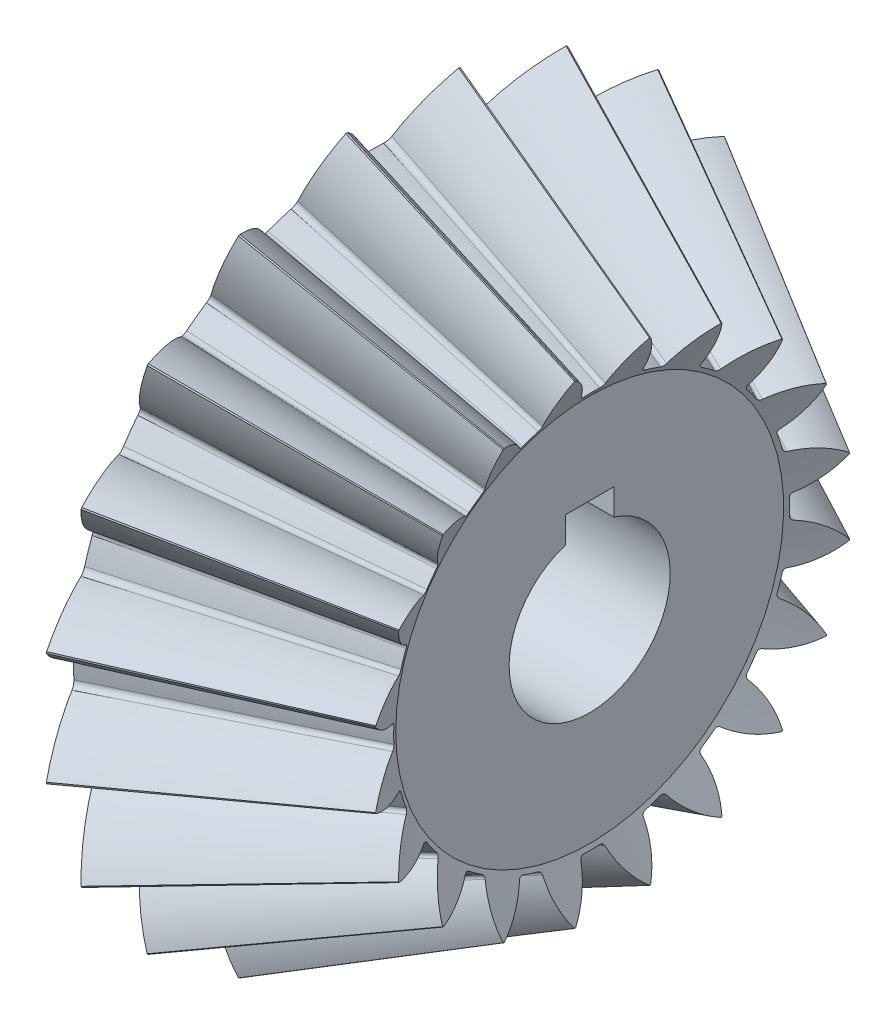
from build123d import *

# Parameters (mm, degrees)
TEETHCUTS_COUNT = 20
TEETHCUTS_ANGLE = 342
HUBSKE_R        = 20
HUB_DEPTH       = 8.114537278
BORSKE_R        = 10
BORE_DEPTH      = 90.0000508
KEYSKE_W        = 6
KEYSKE_H        = 12.8
KEYWAY_DEPTH    = 90.0000508


with BuildPart() as part:
    # BasProSke → Base-Revolve (revolve)
    with BuildSketch(Plane(origin=(0, 0, 0), x_dir=(1, 0, 0), z_dir=(0, 1, 0)), mode=Mode.PRIVATE) as base_revolve_sk:
        Polygon((0, 0), (0, 36.228871357), (4.29157347, 44.812018286), (30.317389192, 29.781610406), (27.465253224, 24.077338479), (27.465253224, 0), align=None)
    revolve(base_revolve_sk.sketch.rotate(Axis((-10, 0, 0), (1, 0, 0)), 180), axis=Axis((-10, 0, 0), (1, 0, 0)))

    # ToothCut: read off the stored shape, not the designer's step
    # ToothCut: loft between two sections, ruled curve by curve
    toothcut_from = [
        Edge.make_bspline([(81.888933635, 0.006738621, -0.010223894), (81.886373247, 0.001617846, -0.014442833), (81.883216481, -0.004695686, -0.013575936), (81.881188729, -0.008751189, -0.008097023)], [0, 0, 0, 0, 1, 1, 1, 1], 3, [1, 0.817810114, 0.817810114, 1]),
        Edge.make_bspline([(81.881188729, -0.008751189, 0.008097023), (81.883216481, -0.004695686, 0.013575936), (81.886373247, 0.001617846, 0.014442833), (81.888933635, 0.006738621, 0.010223894)], [0, 0, 0, 0, 1, 1, 1, 1], 3, [1, 0.817810114, 0.817810114, 1]),
        Edge.make_bspline([(81.881188729, -0.008751189, -0.008097023), (81.880870911, -0.009386825, -0.00723829), (81.880606097, -0.009916453, -0.006293922), (81.880398844, -0.010330959, -0.00528017)], [0, 0, 0, 0, 1, 1, 1, 1], 3, [1, 0.994263946, 0.994263946, 1]),
        Edge.make_bspline([(81.880398844, -0.010330959, 0.00528017), (81.880606097, -0.009916453, 0.006293922), (81.880870911, -0.009386825, 0.00723829), (81.881188729, -0.008751189, 0.008097023)], [0, 0, 0, 0, 1, 1, 1, 1], 3, [1, 0.994263946, 0.994263946, 1]),
        Edge.make_bspline([(81.880398844, -0.010330959, -0.00528017), (81.879702298, -0.011724052, -0.0018731), (81.879702298, -0.011724052, 0.0018731), (81.880398844, -0.010330959, 0.00528017)], [0, 0, 0, 0, 1, 1, 1, 1], 3, [1, 0.939649153, 0.939649153, 1]),
        Edge.make_line((81.888933635, 0.006738621, 0.010223894), (81.888933635, 0.006738621, -0.010223894)),
    ]
    toothcut_to = [
        Edge.make_bspline([(4.40365816, 45.036187664, -7.770946678), (3.430833377, 43.090538102, -5.047579314), (2.123323312, 40.475517975, -3.150013178), (0.614801209, 37.458473774, -2.272245878)], [0, 0, 0, 0, 1, 1, 1, 1], 3, [1, 0.965921678, 0.965921678, 1]),
        Edge.make_bspline([(0.614801209, 37.458473774, 2.272245878), (2.123323312, 40.475517975, 3.150013178), (3.430833377, 43.090538102, 5.047579314), (4.40365816, 45.036187664, 7.770946678)], [0, 0, 0, 0, 1, 1, 1, 1], 3, [1, 0.965921678, 0.965921678, 1]),
        Edge.make_bspline([(0.614801209, 37.458473774, -2.272245878), (0.454744156, 37.138359667, -2.179113104), (0.356313014, 36.941497384, -1.881923658), (0.363142279, 36.955155915, -1.512421532)], [0, 0, 0, 0, 1, 1, 1, 1], 3, [1, 0.852233433, 0.852233433, 1]),
        Edge.make_bspline([(0.363142279, 36.955155915, 1.512421532), (0.356313014, 36.941497384, 1.881923658), (0.454744156, 37.138359667, 2.179113104), (0.614801209, 37.458473774, 2.272245878)], [0, 0, 0, 0, 1, 1, 1, 1], 3, [1, 0.852233433, 0.852233433, 1]),
        Edge.make_bspline([(0.363142279, 36.955155915, -1.512421532), (0.381772376, 36.992416108, -0.504427328), (0.381772376, 36.992416108, 0.504427328), (0.363142279, 36.955155915, 1.512421532)], [0, 0, 0, 0, 1, 1, 1, 1], 3, [1, 0.9994314, 0.9994314, 1]),
        Edge.make_line((4.40365816, 45.036187664, 7.770946678), (4.40365816, 45.036187664, -7.770946678)),
    ]
    toothcut = Solid(Shell([*[Face.make_surface_from_curves(toothcut_from[k], toothcut_to[k]) for k in range(6)], Face(Wire(toothcut_from)), Face(Wire(toothcut_to))]))
    add(toothcut, mode=Mode.SUBTRACT)

    # TeethCuts: ToothCut ×20 about axis
    teethcuts_axis = Axis((-10, 0, 0), (1, 0, 0))
    for i in range(1, TEETHCUTS_COUNT):
        add(toothcut.rotate(teethcuts_axis, i * TEETHCUTS_ANGLE / (TEETHCUTS_COUNT - 1)), mode=Mode.SUBTRACT)

    # HubSke → Hub (add)
    with BuildSketch(Plane.ZY):
        with Locations(Location((0, 0, 0), (0, 0, 180))):
            Circle(HUBSKE_R)
    extrude(amount=HUB_DEPTH)

    # BorSke → Bore (cut, symmetric)
    with BuildSketch(Plane(origin=(0, 0, 0), x_dir=(0, 0, -1), z_dir=(1, 0, 0))):
        with Locations(Location((0, 0, 0), (0, 0, 180))):
            Circle(BORSKE_R)
    extrude(amount=BORE_DEPTH, both=True, mode=Mode.SUBTRACT)

    # KeySke → Keyway (cut, symmetric)
    with BuildSketch(Plane(origin=(0, 0, 0), x_dir=(0, 0, -1), z_dir=(1, 0, 0))):
        with Locations((0, 6.4)):
            Rectangle(KEYSKE_W, KEYSKE_H)
    extrude(amount=KEYWAY_DEPTH, both=True, mode=Mode.SUBTRACT)


solid = part.part
